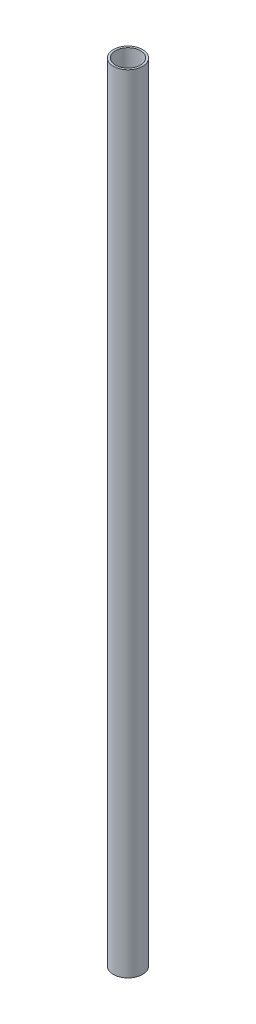
from build123d import *

# Parameters (mm, degrees)
SKETCH1_R           = 12.7
SKETCH1_R_2         = 10.922
BOSS_EXTRUDE2_DEPTH = 685.8


with BuildPart() as part:
    # Sketch1 → Boss-Extrude2 (new body)
    with BuildSketch(Plane(origin=(0, 0, 0), x_dir=(1, 0, 0), z_dir=(0, 1, 0))):
        Circle(SKETCH1_R)
        Circle(SKETCH1_R_2, mode=Mode.SUBTRACT)
    extrude(amount=BOSS_EXTRUDE2_DEPTH)


solid = part.part
